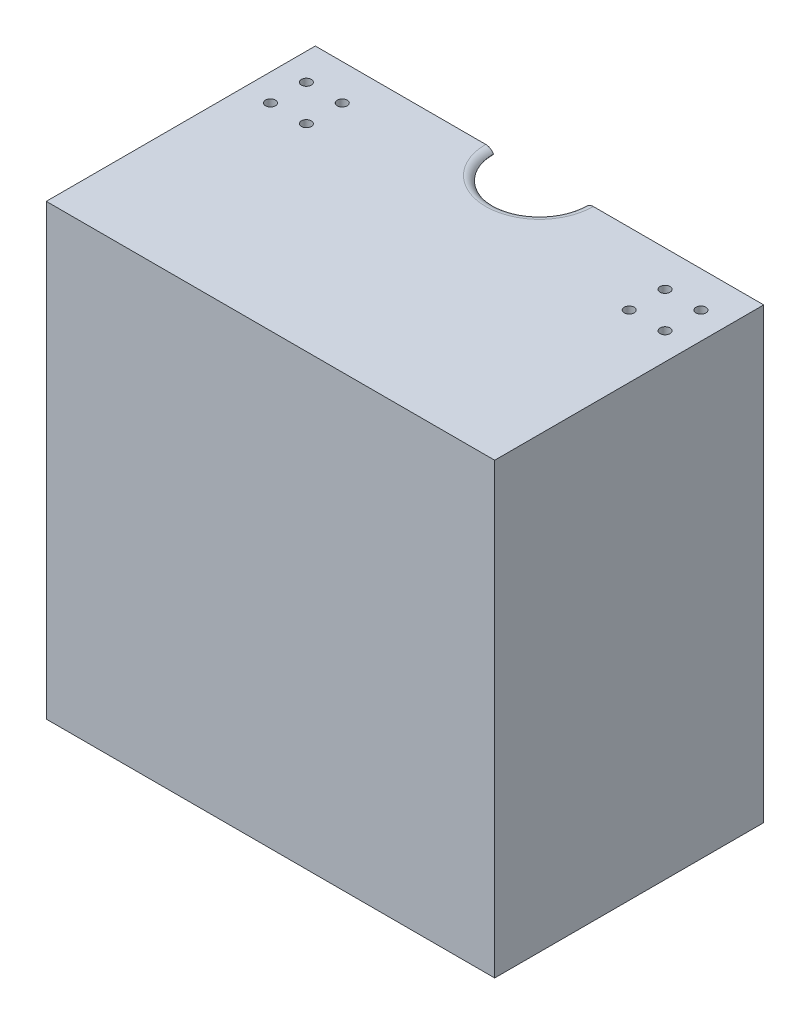
from build123d import *

# Parameters (mm, degrees)
SKETCH1_W               = 127
SKETCH1_H               = 127
BOSS_EXTRUDE1_DEPTH     = 76.2
SHELL2_T                = -2.54
CUT_EXTRUDE1_DEPTH      = 162.144934764
CUT_EXTRUDE1_DEPTH_BACK = 2.54
FILLET3_R               = 2.54
SKETCH3_R               = 1.4097
CUT_EXTRUDE2_DEPTH      = 162.144934764


with BuildPart() as part:
    # Sketch1 → Boss-Extrude1 (new body)
    with BuildSketch(Plane.XY):
        Rectangle(SKETCH1_W, SKETCH1_H)
    extrude(amount=BOSS_EXTRUDE1_DEPTH)

    # Shell2
    shell2_openings = [part.faces().sort_by_distance(p)[0] for p in [
        (0, 0, 0),
    ]]
    offset(amount=SHELL2_T, openings=shell2_openings, kind=Kind.INTERSECTION)

    # Sketch2 → Cut-Extrude1 (cut, two sides: drawn at the far end of the back side and taken through both)
    with BuildSketch(Plane(origin=(0, 63.5, 0), x_dir=(1, 0, 0), z_dir=(0, 1, 0)).offset(-CUT_EXTRUDE1_DEPTH_BACK)):
        with BuildLine():
            Line((-12.7, 225.526146906), (-12.7, 0))
            ThreePointArc((-12.7, 0), (0, -12.7), (12.7, 0))
            Line((12.7, 0), (12.7, 225.526146906))
            Line((12.7, 225.526146906), (12.7, 676.578440717))
            Line((12.7, 676.578440717), (-12.7, 676.578440717))
            Line((-12.7, 676.578440717), (-12.7, 225.526146906))
        make_face()
    extrude(amount=CUT_EXTRUDE1_DEPTH + CUT_EXTRUDE1_DEPTH_BACK, mode=Mode.SUBTRACT)

    # Fillet3
    # the kernel refuses this fillet: 2.54 mm, written as the material it takes off along each edge
    with BuildSketch(Plane(origin=(0, 60.96, 0), x_dir=(-0.8771967747646356, 0, -0.4801310428857115), z_dir=(0.4801310428857115, 0, -0.8771967747646356))) as fillet3_piece_1:
        with BuildLine():
            CenterArc((12.7 + FILLET3_R, FILLET3_R), FILLET3_R, 180, 90)
            Line((12.7 + FILLET3_R, 0), (12.7, 0))
            Line((12.7, 0), (12.7, FILLET3_R))
        make_face()
    revolve(axis=Axis((0, 60.96, 0), (0, 1, 0)), revolution_arc=237.38792196, mode=Mode.SUBTRACT)
    with BuildSketch(Plane(origin=(0, 63.5, 0), x_dir=(0.8771967747646356, 0, -0.4801310428857116), z_dir=(-0.4801310428857116, 0, -0.8771967747646356))) as fillet3_piece_2:
        with BuildLine():
            CenterArc((12.7 + FILLET3_R, FILLET3_R), FILLET3_R, 180, 90)
            Line((12.7, FILLET3_R), (12.7, 0))
            Line((12.7, 0), (12.7 + FILLET3_R, 0))
        make_face()
    revolve(axis=Axis((0, 63.5, 0), (0, -1, 0)), revolution_arc=237.38792196, mode=Mode.SUBTRACT)

    # Sketch3 → Cut-Extrude2 (cut, through all)
    with BuildSketch(Plane.XZ.offset(63.5)):
        with Locations(Location((-55.88, 20.32, 0), (0, 0, 270))):
            Circle(SKETCH3_R)
        with Locations(Location((-45.72, 20.32, 0), (0, 0, 270))):
            Circle(SKETCH3_R)
        with Locations(Location((-55.88, 10.16, 0), (0, 0, 270))):
            Circle(SKETCH3_R)
        with Locations(Location((-45.72, 10.16, 0), (0, 0, 270))):
            Circle(SKETCH3_R)
    cut_extrude2 = extrude(amount=-CUT_EXTRUDE2_DEPTH, mode=Mode.SUBTRACT)

    # Mirror1: Cut-Extrude2 across plane
    add(cut_extrude2.mirror(Plane(origin=(0, 0, 0), x_dir=(0, 0, 1), z_dir=(1, 0, 0))), mode=Mode.SUBTRACT)


solid = part.part
